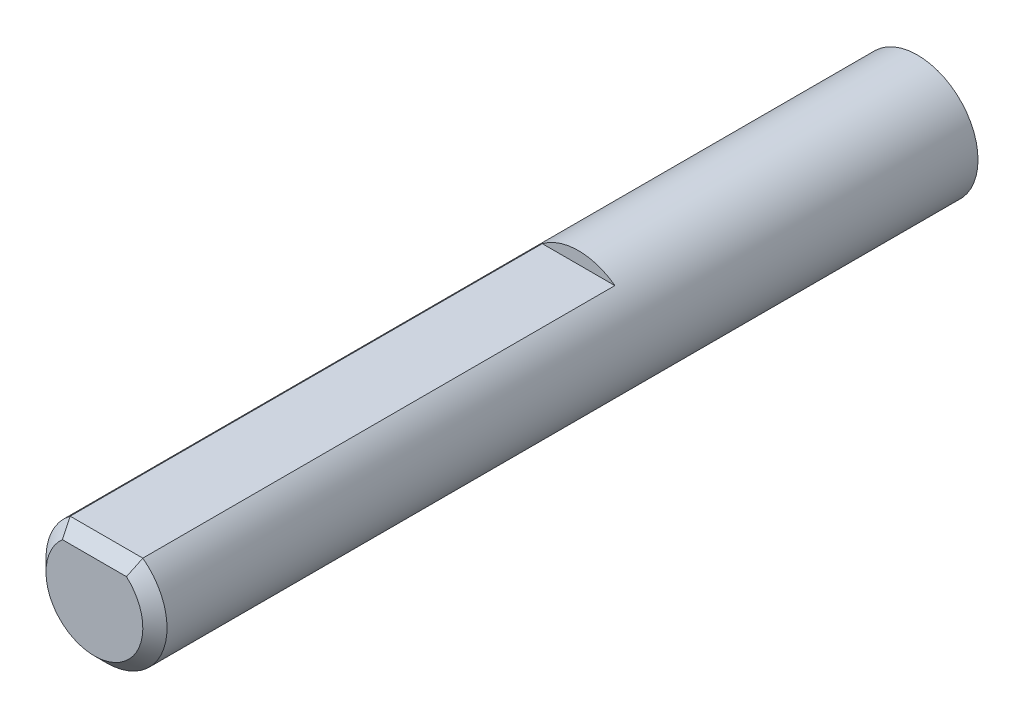
from build123d import *

# Parameters (mm, degrees)
SKETCH_1_R          = 2.5
EXTRUDE_5_DEPTH     = 34
CUT_EXTRUDE_START   = -20
CUT_EXTRUDE_2_DEPTH = 20
CHAMFER_2_SIZE      = 0.5


with BuildPart() as part:
    # 草图1 → 凸台-拉伸5 (new body)
    with BuildSketch(Plane.XY):
        Circle(SKETCH_1_R)
    extrude(amount=EXTRUDE_5_DEPTH)

    # 草图4 → 切除-拉伸2 (cut)
    with BuildSketch(Plane.XY.offset(34).offset(CUT_EXTRUDE_START)):
        with BuildLine():
            Line((-1.5, 2), (1.5, 2))
            ThreePointArc((1.5, 2), (0, 2.5), (-1.5, 2))
        make_face()
    extrude(amount=CUT_EXTRUDE_2_DEPTH, mode=Mode.SUBTRACT)

    # 倒角2
    chamfer_2_edges = [part.edges().sort_by_distance(p)[0] for p in [
        (-1.118033989, -2.236067977, 34),
        (0, 2, 34),
    ]]
    chamfer(chamfer_2_edges, length=CHAMFER_2_SIZE - 0.0001)  # a hair under: the kernel refuses the full size


solid = part.part
